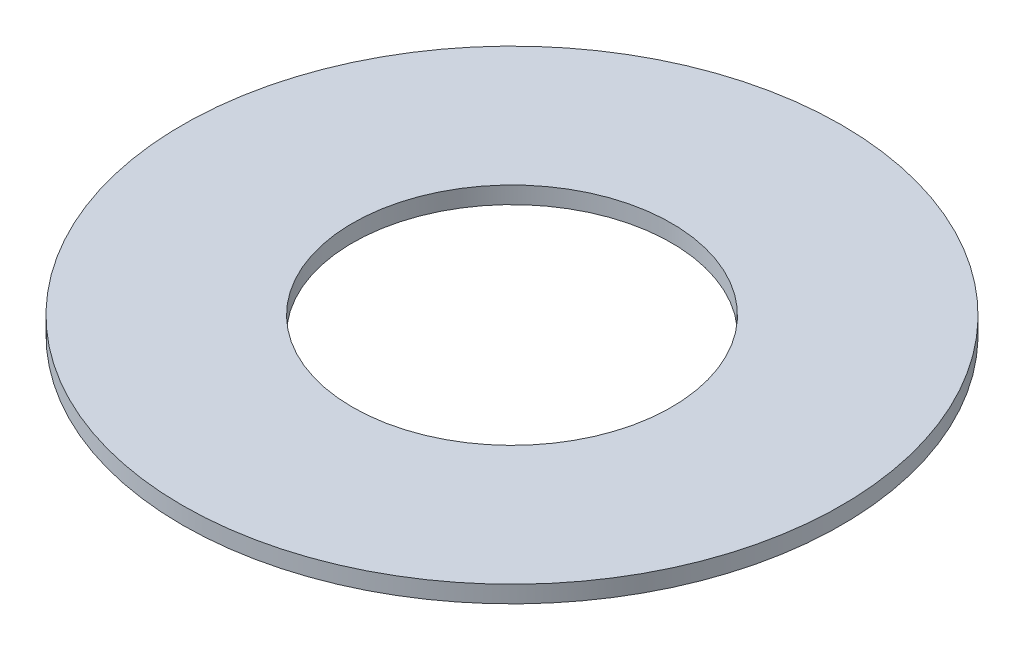
from build123d import *

# Parameters (mm, degrees)
SKETCH1_R           = 77.5
BOSS_EXTRUDE1_DEPTH = 4
SKETCH2_R           = 37.5
CUT_EXTRUDE1_DEPTH  = 110.674518463


with BuildPart() as part:
    # Sketch1 → Boss-Extrude1 (new body)
    with BuildSketch(Plane(origin=(0, 0, 0), x_dir=(1, 0, 0), z_dir=(0, 1, 0))):
        Circle(SKETCH1_R)
    extrude(amount=BOSS_EXTRUDE1_DEPTH)

    # Sketch2 → Cut-Extrude1 (cut, through all)
    with BuildSketch(Plane(origin=(0, 0, 0), x_dir=(1, 0, 0), z_dir=(0, 1, 0))):
        Circle(SKETCH2_R)
    extrude(amount=CUT_EXTRUDE1_DEPTH, mode=Mode.SUBTRACT)


solid = part.part
